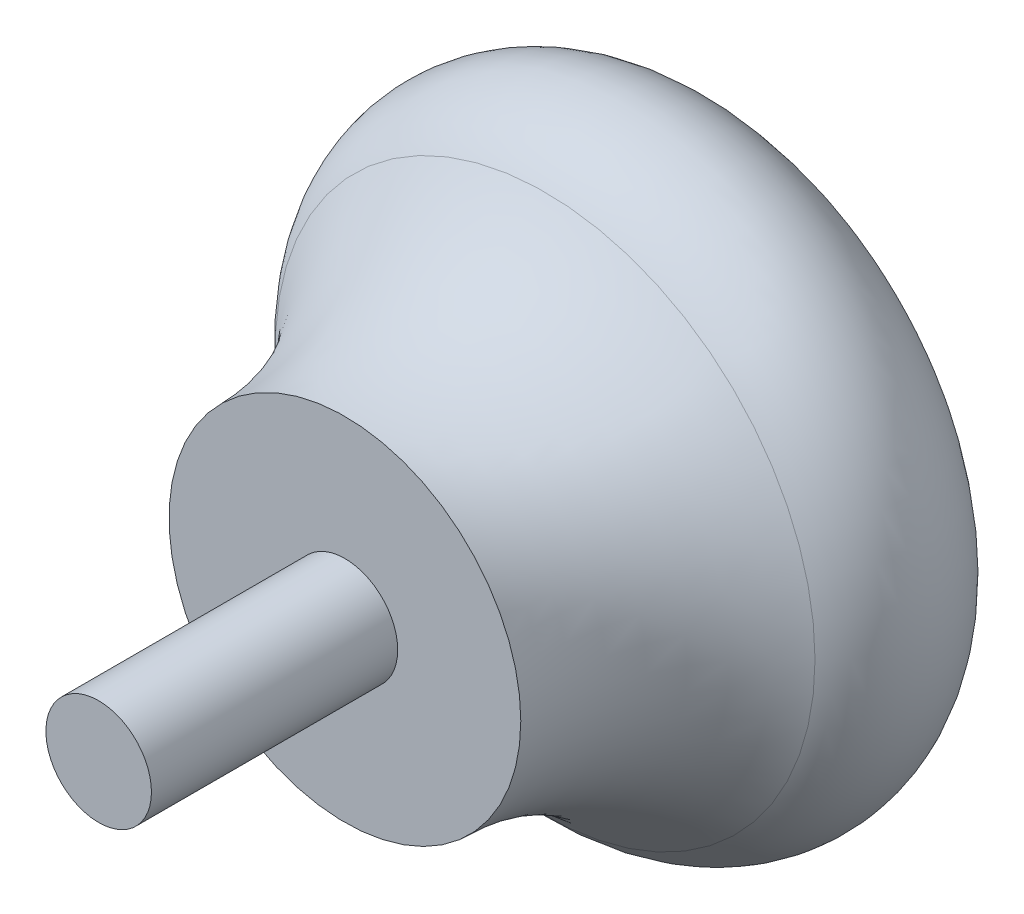
from build123d import *

# Parameters (mm, degrees)
SKETCH1_R           = 10
BOSS_EXTRUDE1_DEPTH = 4
SKETCH2_R           = 5
BOSS_EXTRUDE2_DEPTH = 7
SKETCH3_R           = 1.5
BOSS_EXTRUDE3_DEPTH = 7
FILLET4_R           = 7.4
FILLET15_R          = 4.2
FILLET16_R          = 3


with BuildPart() as part:
    # Sketch1 → Boss-Extrude1 (new body)
    with BuildSketch(Plane.XY):
        Circle(SKETCH1_R)
    extrude(amount=BOSS_EXTRUDE1_DEPTH)

    # Sketch2 → Boss-Extrude2 (add)
    with BuildSketch(Plane.XY.offset(4)):
        Circle(SKETCH2_R)
    extrude(amount=BOSS_EXTRUDE2_DEPTH)

    # Sketch3 → Boss-Extrude3 (add)
    with BuildSketch(Plane.XY.offset(11)):
        Circle(SKETCH3_R)
    extrude(amount=BOSS_EXTRUDE3_DEPTH)

    # Fillet4
    # the kernel refuses this fillet: 7.4 mm, written as the material it adds along each edge
    with BuildSketch(Plane(origin=(0, 0, 4), x_dir=(1, 0, 0), z_dir=(0, -1, 0))) as fillet4_piece_1:
        with BuildLine():
            CenterArc((12.4, 7), FILLET4_R, 180, 71.075355584)
            Line((5, 7), (4.852, 7))
            Line((4.852, 7), (4.852, 0))
            Line((4.852, 0), (5, -0.148))
            ThreePointArc((5, -0.148), (7.5, -0.148), (9.952, -0.14))
            Line((9.952, -0.14), (10, 0))
        make_face()
    revolve(axis=Axis((0, 0, 4), (0, 0, 1)))

    # Fillet15
    # the kernel refuses this fillet: 4.2 mm, written as the material it takes off along each edge
    with BuildSketch(Plane(origin=(0, 0, 0), x_dir=(1, 0, 0), z_dir=(0, -1, 0))) as fillet15_piece_1:
        with BuildLine():
            CenterArc((5.804764607, 4.2), FILLET15_R, 270, 87.270597363)
            Line((5.804764607, 0), (5.804764607, -0.084))
            Line((5.804764607, -0.084), (10, -0.084))
            Line((10, -0.084), (10.084, 0))
            ThreePointArc((10.084, 0), (10.084, 2), (10.083904708, 3.996))
            Line((10.083904708, 3.996), (10, 4))
        make_face()
    revolve(axis=Axis((0, 0, 0), (0, 0, 1)), mode=Mode.SUBTRACT)

    # Fillet16
    fillet16_edges = [part.edges().sort_by_distance(p)[0] for p in [
        (-10, 0, 4),
    ]]
    fillet(fillet16_edges, radius=FILLET16_R)


solid = part.part
